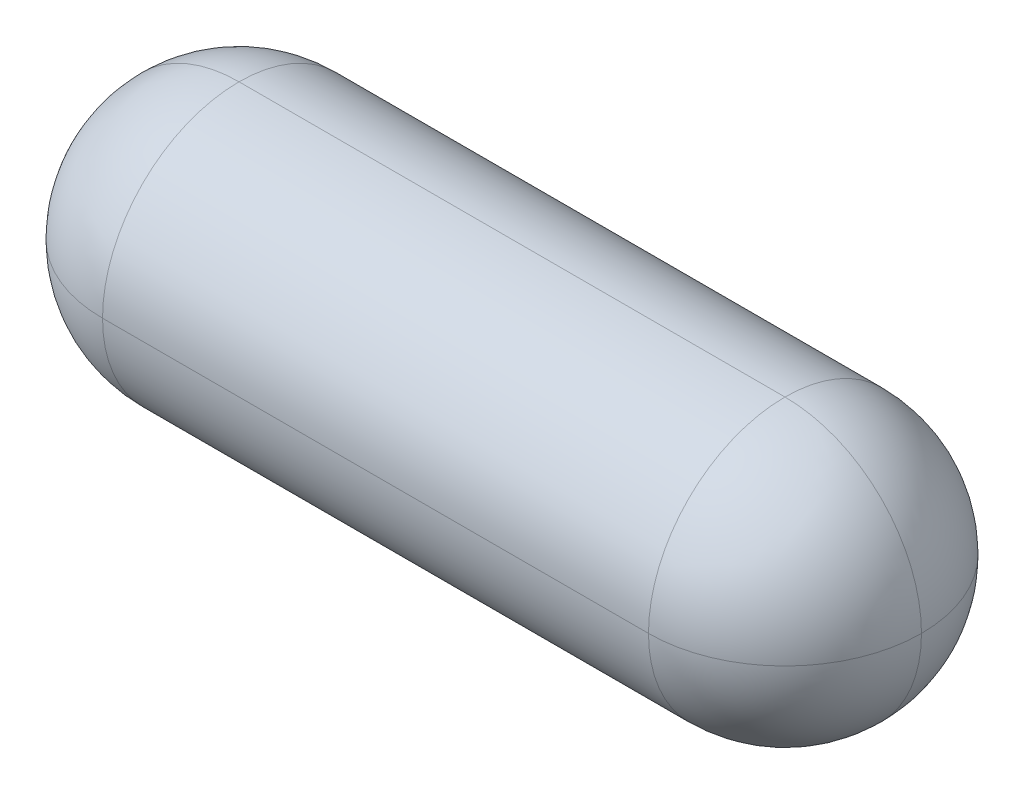
from build123d import *

# Parameters (mm, degrees)
SKETCH1_W           = 18
SKETCH1_H           = 6
BOSS_EXTRUDE1_DEPTH = 6
FILLET1_R           = 3
FILLET2_R           = 3


with BuildPart() as part:
    # Sketch1 → Boss-Extrude1 (new body)
    with BuildSketch(Plane.XY):
        with Locations((8.022761194, -2.524813433)):
            Rectangle(SKETCH1_W, SKETCH1_H)
    extrude(amount=BOSS_EXTRUDE1_DEPTH)

    # Fillet1
    fillet1_edges = [part.edges().sort_by_distance(p)[0] for p in [
        (8.022761194, -5.524813433, 6),
        (8.022761194, -5.524813433, 0),
        (8.022761194, 0.475186567, 0),
        (8.022761194, 0.475186567, 6),
    ]]
    fillet(fillet1_edges, radius=FILLET1_R - 0.0001)  # a hair under: the kernel refuses the full size

    # Fillet2
    fillet2_edges = [part.edges().sort_by_distance(p)[0] for p in [
        (17.022761194, -0.4034638, 5.121349633),
        (17.022761194, -0.4034638, 0.878650367),
        (17.022761194, -4.646163066, 0.878650367),
        (17.022761194, -4.646163066, 5.121349633),
        (-0.977238806, -0.4034638, 5.121349633),
        (-0.977238806, -0.4034638, 0.878650367),
        (-0.977238806, -4.646163066, 0.878650367),
        (-0.977238806, -4.646163066, 5.121349633),
    ]]
    fillet(fillet2_edges, radius=FILLET2_R - 0.0001)  # a hair under: the kernel refuses the full size


solid = part.part
